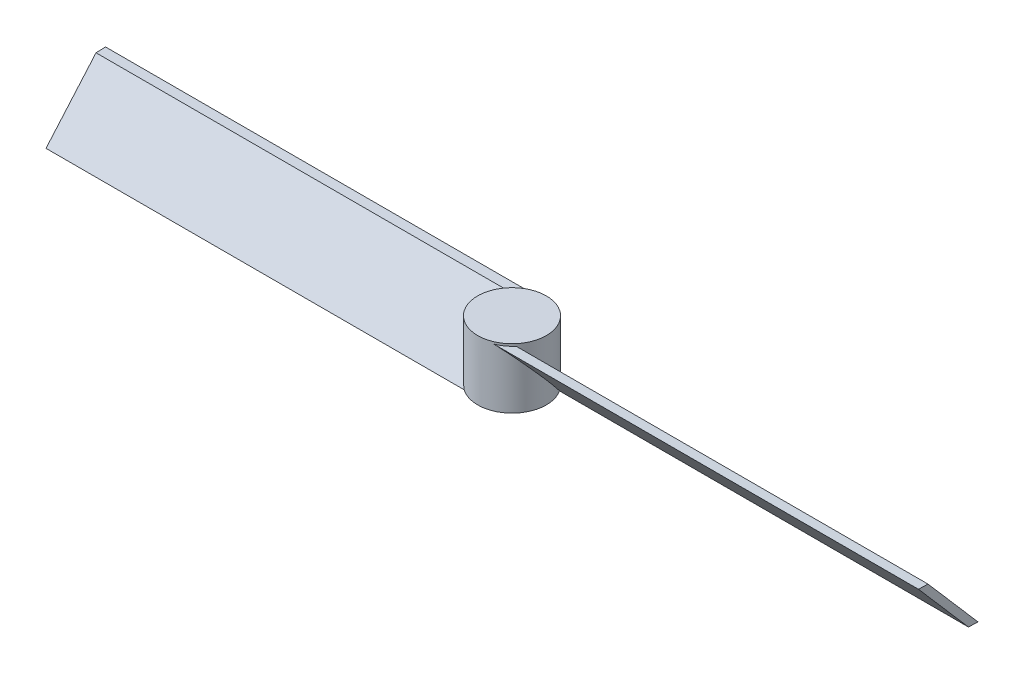
from build123d import *
from build123d.topology import SkipClean

# Parameters (mm, degrees)
SKETCH1_R           = 2
BOSS_EXTRUDE1_DEPTH = 3.5
SKETCH2_R           = 0.42
CUT_EXTRUDE1_DEPTH  = 2.5
BOSS_EXTRUDE2_DEPTH = 25.5
BOSS_EXTRUDE3_DEPTH = 25.5


with BuildPart() as part:
    # Sketch1 → Boss-Extrude1 (new body)
    with BuildSketch(Plane(origin=(0, 0, 0), x_dir=(1, 0, 0), z_dir=(0, 1, 0))):
        Circle(SKETCH1_R)
    extrude(amount=BOSS_EXTRUDE1_DEPTH)

    # Sketch2 → Cut-Extrude1 (cut)
    with BuildSketch(Plane(origin=(0, 0, 0), x_dir=(1, 0, 0), z_dir=(0, 1, 0))):
        Circle(SKETCH2_R)
    extrude(amount=CUT_EXTRUDE1_DEPTH, mode=Mode.SUBTRACT)

    # Sketch3 → Boss-Extrude2 (add)
    with SkipClean():  # the faces are left unmerged after this step: merging them gives an invalid solid
        with BuildSketch(Plane(origin=(0, 0, 0), x_dir=(0, 0, -1), z_dir=(1, 0, 0))):
            Polygon((1.627531183, 0), (-1.283933552, 3.362939097), (-1.838612291, 3.379776249), (1.072852444, 0.016837151), align=None)
        extrude(amount=BOSS_EXTRUDE2_DEPTH)

    # Sketch4 → Boss-Extrude3 (add)
    with SkipClean():  # the faces are left unmerged after this step: merging them gives an invalid solid
        with BuildSketch(Plane.ZY):
            Polygon((1.627531183, 0), (-1.283933552, 3.362939097), (-1.838612291, 3.379776249), (1.072852444, 0.016837151), align=None)
        extrude(amount=BOSS_EXTRUDE3_DEPTH)


solid = part.part
